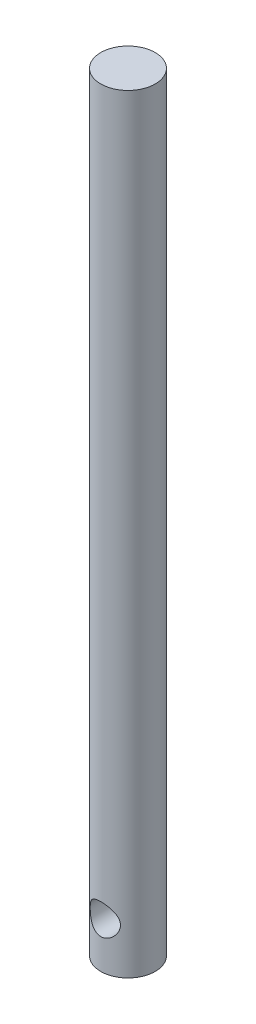
from build123d import *

# Parameters (mm, degrees)
SKETCH5_R           = 9
BOSS_EXTRUDE2_DEPTH = 254
SKETCH7_R           = 5
CUT_EXTRUDE2_DEPTH  = 50


with BuildPart() as part:
    # Sketch5 → Boss-Extrude2 (new body)
    with BuildSketch(Plane(origin=(0, 0, 0), x_dir=(1, 0, 0), z_dir=(0, 1, 0))):
        with Locations((32.666511495, 0)):
            Circle(SKETCH5_R)
    extrude(amount=BOSS_EXTRUDE2_DEPTH)

    # Sketch7 → Cut-Extrude2 (cut)
    with BuildSketch(Plane.XY.offset(9)):
        with Locations((32.666511495, 15)):
            Circle(SKETCH7_R)
    extrude(amount=-CUT_EXTRUDE2_DEPTH, mode=Mode.SUBTRACT)


solid = part.part
